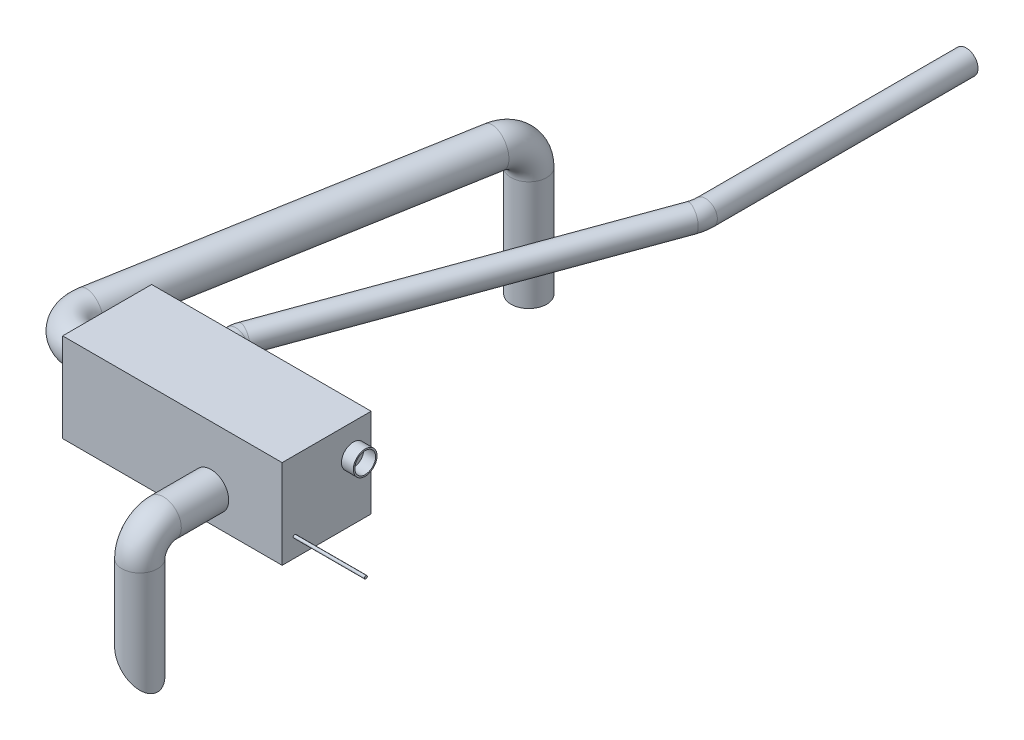
from build123d import *

# Parameters (mm, degrees)
SKETCH1_W           = 939.8
SKETCH1_H           = 381
BOSS_EXTRUDE1_DEPTH = 381
SKETCH2_R           = 76.2
SKETCH2_R_2         = 69.85
BOSS_EXTRUDE2_DEPTH = 177.8
SKETCH3_R           = 50.8
SKETCH3_R_2         = 44.45
BOSS_EXTRUDE3_DEPTH = 50.8
SKETCH4_R           = 6.35
BOSS_EXTRUDE4_DEPTH = 304.8
SKETCH5_R           = 50.8
SKETCH5_R_2         = 44.45
BOSS_EXTRUDE5_DEPTH = 50.8
SKETCH6_R           = 76.2
SKETCH6_R_2         = 69.85
BOSS_EXTRUDE6_DEPTH = 50.8
SKETCH7_R           = 76.2
SKETCH7_R_2         = 69.85
SKETCH14_R          = 50.8
SKETCH14_R_2        = 44.45
SKETCH19_R          = 76.2
SKETCH19_R_2        = 69.85
SKETCH21_R          = 76.2
SKETCH21_R_2        = 69.85
CUT_EXTRUDE3_DEPTH  = 3185.358238928


with BuildPart() as part:
    # Sketch1 → Boss-Extrude1 (new body)
    with BuildSketch(Plane(origin=(0, 0, 0), x_dir=(1, 0, 0), z_dir=(0, 1, 0))):
        Rectangle(SKETCH1_W, SKETCH1_H)
    extrude(amount=BOSS_EXTRUDE1_DEPTH)

    # Sketch2 → Boss-Extrude2 (add)
    with BuildSketch(Plane.XY.offset(190.5)):
        with Locations((165.1, 127)):
            Circle(SKETCH2_R)
        with Locations((165.1, 127)):
            Circle(SKETCH2_R_2, mode=Mode.SUBTRACT)
    extrude(amount=BOSS_EXTRUDE2_DEPTH)

    # Sketch3 → Boss-Extrude3 (add)
    with BuildSketch(Plane(origin=(469.9, 0, 0), x_dir=(0, 0, -1), z_dir=(1, 0, 0))):
        with Locations((114.3, 254)):
            Circle(SKETCH3_R)
        with Locations((114.3, 254)):
            Circle(SKETCH3_R_2, mode=Mode.SUBTRACT)
    extrude(amount=BOSS_EXTRUDE3_DEPTH)

    # Sketch4 → Boss-Extrude4 (add)
    with BuildSketch(Plane(origin=(469.9, 0, 0), x_dir=(0, 0, -1), z_dir=(1, 0, 0))):
        with Locations((-136.850125002, 81.35113945)):
            Circle(SKETCH4_R)
    extrude(amount=BOSS_EXTRUDE4_DEPTH)

    # Sketch5 → Boss-Extrude5 (add)
    with BuildSketch(Plane(origin=(0, 0, -190.5), x_dir=(-1, 0, 0), z_dir=(0, 0, -1))):
        with Locations((185.69264526, 273.888159849)):
            Circle(SKETCH5_R)
        with Locations((185.69264526, 273.888159849)):
            Circle(SKETCH5_R_2, mode=Mode.SUBTRACT)
    extrude(amount=BOSS_EXTRUDE5_DEPTH)

    # Sketch6 → Boss-Extrude6 (add)
    with BuildSketch(Plane.ZY.offset(469.9)):
        with Locations((0, 190.5)):
            Circle(SKETCH6_R)
        with Locations((0, 190.5)):
            Circle(SKETCH6_R_2, mode=Mode.SUBTRACT)
    extrude(amount=BOSS_EXTRUDE6_DEPTH)

    # Sweep1: sweep along a path in Sketch8
    with BuildLine(Plane(origin=(165.1, 0, 0), x_dir=(0, 0, -1), z_dir=(1, 0, 0))) as sweep1_path:
        Line((-368.3, 127), (-393.7, 127))
        ThreePointArc((-393.7, 127), (-465.542048969, 97.242048969), (-495.3, 25.4))
        Line((-495.3, 25.4), (-495.3, -431.8))
    # Sketch7 → Sweep1 (sweep)
    with BuildSketch(Plane.XY.offset(368.3)):
        with Locations((165.1, 127)):
            Circle(SKETCH7_R)
        with Locations((165.1, 127)):
            Circle(SKETCH7_R_2, mode=Mode.SUBTRACT)
    sweep(path=sweep1_path.line)

    # Sweep5: sweep along a path in Sketch13
    with BuildLine(Plane(origin=(0, 273.888159849, 0), x_dir=(1, 0, 0), z_dir=(0, 1, 0))) as sweep5_path:
        Line((-185.69264526, 241.3), (-185.69264526, 266.7))
        ThreePointArc((-185.69264526, 266.7), (-184.534996039, 279.931991138), (-181.097222964, 292.761934921))
        Line((-181.097222964, 292.761934921), (330.950630872, 1699.601851016))
        ThreePointArc((330.950630872, 1699.601851016), (337.826177024, 1725.261738583), (340.141475465, 1751.725720859))
        Line((340.141475465, 1751.725720859), (340.141475465, 2867.853488999))
    # Sketch14 → Sweep5 (sweep)
    with BuildSketch(Plane(origin=(0, 0, -241.3), x_dir=(-1, 0, 0), z_dir=(0, 0, -1))):
        with Locations((185.69264526, 273.888159849)):
            Circle(SKETCH14_R)
        with Locations((185.69264526, 273.888159849)):
            Circle(SKETCH14_R_2, mode=Mode.SUBTRACT)
    sweep(path=sweep5_path.line)

    # Sweep7: sweep along a path in Sketch18
    with BuildLine(Plane(origin=(0, 190.5, 0), x_dir=(1, 0, 0), z_dir=(0, 1, 0))) as sweep7_path:
        Line((-520.7, 0), (-571.5, 0))
        ThreePointArc((-571.5, 0), (-668.787644276, 45.36597357), (-696.570584633, 149.053318564))
        Line((-696.570584633, 149.053318564), (-440.752089294, 1599.872100301))
    # Sketch19 → Sweep7 (sweep)
    with BuildSketch(Plane.ZY.offset(520.7)):
        with Locations((0, 190.5)):
            Circle(SKETCH19_R)
        with Locations((0, 190.5)):
            Circle(SKETCH19_R_2, mode=Mode.SUBTRACT)
    sweep(path=sweep7_path.line)

    # Sweep8: sweep along a path in Sketch20
    with BuildLine(Plane(origin=(-701.056030123, 0, -123.615093099), x_dir=(-0.17364817766693416, 0, 0.9848077530122074), z_dir=(-0.9848077530122075, 0, -0.17364817766693416))) as sweep8_path:
        Line((-1499.030651096, 190.5), (-1524.430651096, 190.5))
        ThreePointArc((-1524.430651096, 190.5), (-1614.233212307, 153.302561211), (-1651.430651096, 63.5))
        Line((-1651.430651096, 63.5), (-1651.430651096, -406.4))
    # Sketch21 → Sweep8 (sweep)
    with BuildSketch(Plane(origin=(260.30394083, 0, -1476.257007202), x_dir=(-0.9848077530122072, 0, -0.17364817766693594), z_dir=(0.17364817766693594, 0, -0.9848077530122072))):
        with Locations((711.87094941, 190.5)):
            Circle(SKETCH21_R)
        with Locations((711.87094941, 190.5)):
            Circle(SKETCH21_R_2, mode=Mode.SUBTRACT)
    sweep(path=sweep8_path.line)

    # Sketch22 → Cut-Extrude3 (cut, through all)
    with BuildSketch(Plane.XY.offset(190.5)):
        Polygon((88.9, -279.4), (241.3, -431.8), (88.9, -431.8), align=None)
    extrude(amount=CUT_EXTRUDE3_DEPTH, mode=Mode.SUBTRACT)


solid = part.part
